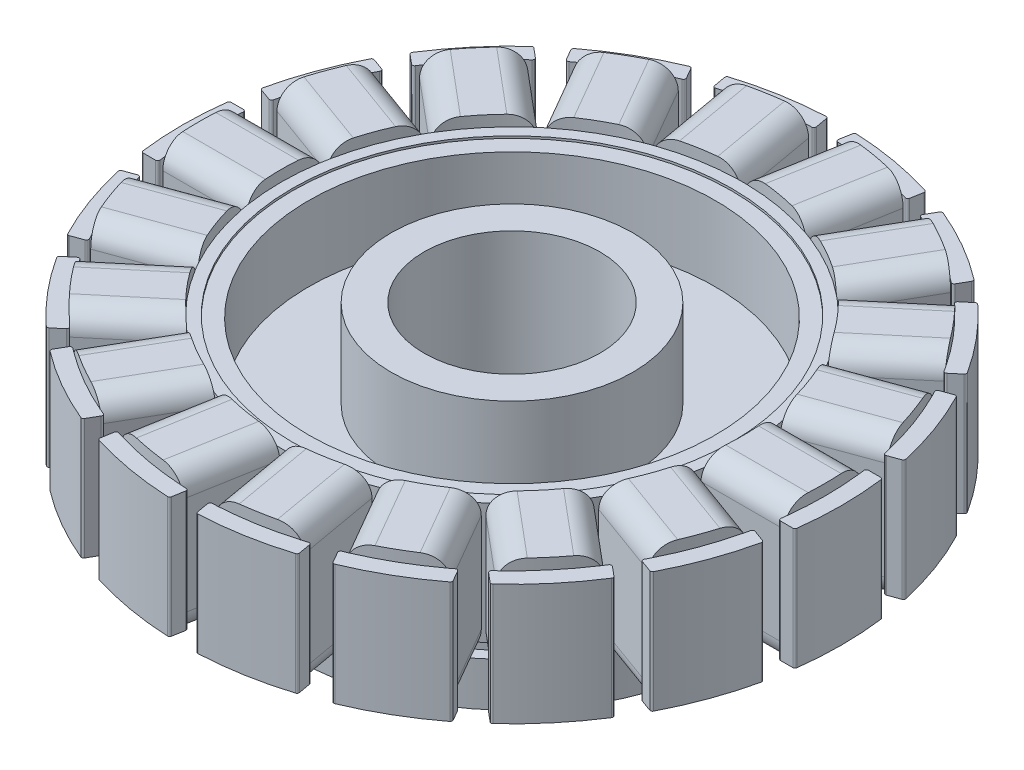
from build123d import *

# Parameters (mm, degrees)
SKETCH_1_R                       = 20
EXTRUDE_1_DEPTH                  = 4
SKETCH_2_R                       = 12.5
CUT_EXTRUDE_1_DEPTH              = 1
CHAMFER_1_SIZE                   = 1
SKETCH_3_R                       = 19
EXTRUDE_2_DEPTH                  = 1
SKETCH_4_R                       = 21
EXTRUDE_3_DEPTH                  = 13
EXTRUDE_START                    = -13
EXTRUDE_5_DEPTH                  = 13
FILLET_2_R                       = 2
PATTERN_CIRCULAR_1_COUNT         = 18
FILLET_2_OF_PATTERN_CIRCULAR_1_R = 2
CUT_EXTRUDE_START                = -1
SKETCH_6_R                       = 30
SKETCH_6_R_2                     = 28.5
CUT_EXTRUDE_2_DEPTH              = 1
SKETCH_7_R                       = 8
CUT_EXTRUDE_3_DEPTH              = 21
SKETCH_8_R                       = 18.5
CUT_EXTRUDE_4_DEPTH              = 8
SKETCH_9_R                       = 11
SKETCH_9_R_2                     = 8
EXTRUDE_6_DEPTH                  = 8
HOLE_WIZARD_M3_1_D               = 2.5
HOLE_WIZARD_M3_1_DEPTH           = 7.5
HOLE_WIZARD_M3_1_TIP             = 0.751075774
SKETCH_13_R                      = 21
SKETCH_13_R_2                    = 18.5
CUT_EXTRUDE_5_DEPTH              = 1
SKETCH_14_R                      = 20
SKETCH_14_R_2                    = 18.5
CUT_EXTRUDE_6_DEPTH              = 0.2
SKETCH_15_R                      = 30
SKETCH_15_R_2                    = 28.5
CUT_EXTRUDE_7_DEPTH              = 1
SKETCH_16_R                      = 21
SKETCH_16_R_2                    = 19.575975565
CUT_EXTRUDE_8_DEPTH              = 1


with BuildPart() as part:
    # 草图1 → 凸台-拉伸1 (new body)
    with BuildSketch(Plane(origin=(0, 0, 0), x_dir=(1, 0, 0), z_dir=(0, 1, 0))):
        with Locations(Location((0, 0, 0), (0, 0, 270))):
            Circle(SKETCH_1_R)
    extrude(amount=EXTRUDE_1_DEPTH)

    # 草图2 → 切除-拉伸1 (cut)
    with BuildSketch(Plane(origin=(0, 0, 0), x_dir=(-1, 0, 0), z_dir=(0, -1, 0))):
        with Locations(Location((0, 0, 0), (0, 0, 90))):
            Circle(SKETCH_2_R)
    extrude(amount=-CUT_EXTRUDE_1_DEPTH, mode=Mode.SUBTRACT)

    # 倒角1
    chamfer_1_edges = [part.edges().sort_by_distance(p)[0] for p in [
        (0, 1, 12.5),
    ]]
    chamfer(chamfer_1_edges, length=CHAMFER_1_SIZE - 0.0001)  # a hair under: the kernel refuses the full size

    # 草图3 → 凸台-拉伸2 (add)
    with BuildSketch(Plane(origin=(0, 4, 0), x_dir=(1, 0, 0), z_dir=(0, 1, 0))):
        with Locations(Location((0, 0, 0), (0, 0, 270))):
            Circle(SKETCH_3_R)
    extrude(amount=EXTRUDE_2_DEPTH)

    # 草图4 → 凸台-拉伸3 (add)
    with BuildSketch(Plane(origin=(0, 5, 0), x_dir=(1, 0, 0), z_dir=(0, 1, 0))):
        with Locations(Location((0, 0, 0), (0, 0, 90))):
            Circle(SKETCH_4_R)
    extrude(amount=EXTRUDE_3_DEPTH)

    # 草图5 → 凸台-拉伸5 (add)
    with BuildSketch(Plane(origin=(0, 18, 0), x_dir=(1, 0, 0), z_dir=(0, 1, 0)).offset(EXTRUDE_START)):
        with BuildLine():
            Line((20.706279241, -3.5), (28.284271247, -3.5))
            ThreePointArc((28.284271247, -3.5), (28.267006742, -3.636802146), (28.249080571, -3.773519164))
            ThreePointArc((28.249080571, -3.773519164), (28.296826931, -3.931726673), (28.447319733, -4))
            Line((28.447319733, -4), (29.556725123, -4))
            ThreePointArc((29.556725123, -4), (29.688822301, -3.950167692), (29.755092406, -3.825503356))
            ThreePointArc((29.755092406, -3.825503356), (30, 0), (29.755092406, 3.825503356))
            ThreePointArc((29.755092406, 3.825503356), (29.688822301, 3.950167692), (29.556725123, 4))
            Line((29.556725123, 4), (28.447319733, 4))
            ThreePointArc((28.447319733, 4), (28.296826931, 3.931726673), (28.249080571, 3.773519164))
            ThreePointArc((28.249080571, 3.773519164), (28.267006742, 3.636802146), (28.284271247, 3.5))
            Line((28.284271247, 3.5), (20.706279241, 3.5))
            ThreePointArc((20.706279241, 3.5), (21, 0), (20.706279241, -3.5))
        make_face()
    extrude_5 = extrude(amount=EXTRUDE_5_DEPTH)

    # 圆角2
    fillet_2_edges = [part.edges().sort_by_distance(p)[0] for p in [
        (24.495275244, 5, 3.5),
        (24.495275244, 5, -3.5),
        (24.495275244, 18, -3.5),
        (24.495275244, 18, 3.5),
    ]]
    fillet(fillet_2_edges, radius=FILLET_2_R)

    # 阵列(圆周)1: 凸台-拉伸5 ×18 about axis
    pattern_circular_1_axis = Axis((0, 0, 0), (0, 1, 0))
    for i in range(1, PATTERN_CIRCULAR_1_COUNT):
        add(extrude_5.rotate(pattern_circular_1_axis, i * 360 / PATTERN_CIRCULAR_1_COUNT))

    # 圆角2 of 阵列(圆周)1
    fillet_2_of_pattern_circular_1_edges = [part.edges().sort_by_distance(p)[0] for p in [
        (24.215099893, 5, -5.088953377),
        (21.820958889, 5, -11.666801723),
        (21.820958889, 18, -11.666801723),
        (24.215099893, 18, -5.088953377),
        (21.014226117, 5, -13.064103872),
        (16.51471285, 5, -18.426414974),
        (16.51471285, 18, -18.426414974),
        (21.014226117, 18, -13.064103872),
        (15.278726535, 5, -19.463530634),
        (9.216548709, 5, -22.963530634),
        (9.216548709, 18, -22.963530634),
        (15.278726535, 18, -19.463530634),
        (7.700387043, 5, -23.515368351),
        (0.806732772, 5, -24.730905594),
        (0.806732772, 18, -24.730905594),
        (7.700387043, 18, -23.515368351),
        (-0.806732772, 5, -24.730905594),
        (-7.700387043, 5, -23.515368351),
        (-7.700387043, 18, -23.515368351),
        (-0.806732772, 18, -24.730905594),
        (-9.216548709, 5, -22.963530634),
        (-15.278726535, 5, -19.463530634),
        (-15.278726535, 18, -19.463530634),
        (-9.216548709, 18, -22.963530634),
        (-16.51471285, 5, -18.426414974),
        (-21.014226117, 5, -13.064103872),
        (-21.014226117, 18, -13.064103872),
        (-16.51471285, 18, -18.426414974),
        (-21.820958889, 5, -11.666801723),
        (-24.215099893, 5, -5.088953377),
        (-24.215099893, 18, -5.088953377),
        (-21.820958889, 18, -11.666801723),
        (-24.495275244, 5, -3.5),
        (-24.495275244, 5, 3.5),
        (-24.495275244, 18, 3.5),
        (-24.495275244, 18, -3.5),
        (-24.215099893, 5, 5.088953377),
        (-21.820958889, 5, 11.666801723),
        (-21.820958889, 18, 11.666801723),
        (-24.215099893, 18, 5.088953377),
        (-21.014226117, 5, 13.064103872),
        (-16.51471285, 5, 18.426414974),
        (-16.51471285, 18, 18.426414974),
        (-21.014226117, 18, 13.064103872),
        (-15.278726535, 5, 19.463530634),
        (-9.216548709, 5, 22.963530634),
        (-9.216548709, 18, 22.963530634),
        (-15.278726535, 18, 19.463530634),
        (-7.700387043, 5, 23.515368351),
        (-0.806732772, 5, 24.730905594),
        (-0.806732772, 18, 24.730905594),
        (-7.700387043, 18, 23.515368351),
        (0.806732772, 5, 24.730905594),
        (7.700387043, 5, 23.515368351),
        (7.700387043, 18, 23.515368351),
        (0.806732772, 18, 24.730905594),
        (9.216548709, 5, 22.963530634),
        (15.278726535, 5, 19.463530634),
        (15.278726535, 18, 19.463530634),
        (9.216548709, 18, 22.963530634),
        (16.51471285, 5, 18.426414974),
        (21.014226117, 5, 13.064103872),
        (21.014226117, 18, 13.064103872),
        (16.51471285, 18, 18.426414974),
        (21.820958889, 5, 11.666801723),
        (24.215099893, 5, 5.088953377),
        (24.215099893, 18, 5.088953377),
        (21.820958889, 18, 11.666801723),
    ]]
    fillet(fillet_2_of_pattern_circular_1_edges, radius=FILLET_2_OF_PATTERN_CIRCULAR_1_R)

    # 草图6 → 切除-拉伸2 (cut)
    with BuildSketch(Plane(origin=(0, 18, 0), x_dir=(1, 0, 0), z_dir=(0, 1, 0)).offset(CUT_EXTRUDE_START)):
        Circle(SKETCH_6_R)
        Circle(SKETCH_6_R_2, mode=Mode.SUBTRACT)
    extrude(amount=CUT_EXTRUDE_2_DEPTH, mode=Mode.SUBTRACT)

    # 草图7 → 切除-拉伸3 (cut)
    with BuildSketch(Plane(origin=(0, 1, 0), x_dir=(-1, 0, 0), z_dir=(0, -1, 0))):
        with Locations(Location((0, 0, 0), (0, 0, 90))):
            Circle(SKETCH_7_R)
    extrude(amount=-CUT_EXTRUDE_3_DEPTH, mode=Mode.SUBTRACT)

    # 草图8 → 切除-拉伸4 (cut)
    with BuildSketch(Plane(origin=(0, 18, 0), x_dir=(1, 0, 0), z_dir=(0, 1, 0))):
        with Locations(Location((0, 0, 0), (0, 0, 270))):
            Circle(SKETCH_8_R)
    extrude(amount=-CUT_EXTRUDE_4_DEPTH, mode=Mode.SUBTRACT)

    # 草图9 → 凸台-拉伸6 (add)
    with BuildSketch(Plane(origin=(0, 10, 0), x_dir=(1, 0, 0), z_dir=(0, 1, 0))):
        with Locations(Location((0, 0, 0), (0, 0, 270))):
            Circle(SKETCH_9_R)
        with Locations(Location((0, 0, 0), (0, 0, 90))):
            Circle(SKETCH_9_R_2, mode=Mode.SUBTRACT)
    extrude(amount=EXTRUDE_6_DEPTH)

    # M3 螺纹孔1
    with Locations(Plane(origin=(0, 0, 0), x_dir=(-1, 0, 0), z_dir=(0, -1, 0))):
        with Locations((11, -11), (-11, -11), (-11, 11), (11, 11)):
            Hole(HOLE_WIZARD_M3_1_D / 2, depth=HOLE_WIZARD_M3_1_DEPTH)
            with Locations((0, 0, -(HOLE_WIZARD_M3_1_DEPTH + HOLE_WIZARD_M3_1_TIP / 2))):  # 118° drill point
                Cone(0, HOLE_WIZARD_M3_1_D / 2, HOLE_WIZARD_M3_1_TIP, mode=Mode.SUBTRACT)

    # 草图13 → 切除-拉伸5 (cut)
    with BuildSketch(Plane(origin=(0, 18, 0), x_dir=(1, 0, 0), z_dir=(0, 1, 0)).offset(CUT_EXTRUDE_START)):
        Circle(SKETCH_13_R)
        with Locations(Location((0, 0, 0), (0, 0, 270))):
            Circle(SKETCH_13_R_2, mode=Mode.SUBTRACT)
    extrude(amount=CUT_EXTRUDE_5_DEPTH, mode=Mode.SUBTRACT)

    # 草图14 → 切除-拉伸6 (cut)
    with BuildSketch(Plane(origin=(0, 17, 0), x_dir=(1, 0, 0), z_dir=(0, 1, 0))):
        with Locations(Location((0, 0, 0), (0, 0, 270))):
            Circle(SKETCH_14_R)
        with Locations(Location((0, 0, 0), (0, 0, 270))):
            Circle(SKETCH_14_R_2, mode=Mode.SUBTRACT)
    extrude(amount=-CUT_EXTRUDE_6_DEPTH, mode=Mode.SUBTRACT)

    # 草图15 → 切除-拉伸7 (cut)
    with BuildSketch(Plane(origin=(0, 5, 0), x_dir=(-1, 0, 0), z_dir=(0, -1, 0))):
        Circle(SKETCH_15_R)
        Circle(SKETCH_15_R_2, mode=Mode.SUBTRACT)
    extrude(amount=-CUT_EXTRUDE_7_DEPTH, mode=Mode.SUBTRACT)

    # 草图16 → 切除-拉伸8 (cut)
    with BuildSketch(Plane(origin=(0, 5, 0), x_dir=(-1, 0, 0), z_dir=(0, -1, 0))):
        Circle(SKETCH_16_R)
        with Locations(Location((0, 0, 0), (0, 0, 90))):
            Circle(SKETCH_16_R_2, mode=Mode.SUBTRACT)
    extrude(amount=-CUT_EXTRUDE_8_DEPTH, mode=Mode.SUBTRACT)


solid = part.part
